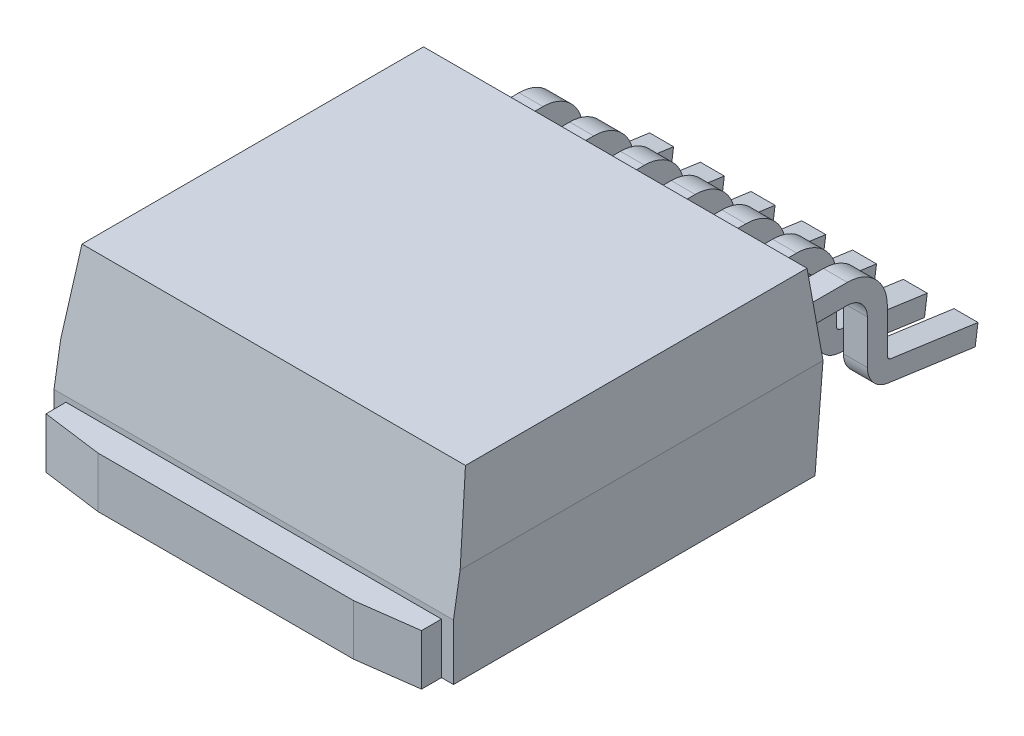
from build123d import *

# Parameters (mm, degrees)
MAIN_BODY_DEPTH               = 5
ICP_CUT_W                     = 8.5
ICP_CUT_H                     = 6.85
BACK_IC_PLATE_CUT_DEPTH       = 1.27
BACK_IC_PLATE_DEPTH           = 1.27
IC_LEG_DEPTH                  = 0.3
IC_LEG_JOINT_COMPLETION_REACH = 13.973
LC_W                          = 0.6
LC_H                          = 0.5
SIDE_CHAMFER_DEPTH            = 12.597722784
LP_START                      = 3.51
LP_IC_LEGS_DEPTH              = 0.6
LP_START_2                    = 2.24
LP_IC_LEGS_2_DEPTH            = 0.6
LP_START_3                    = 0.97
LP_IC_LEGS_3_DEPTH            = 0.6
LP_START_4                    = -4.11
LP_IC_LEGS_4_DEPTH            = 0.6
LP_START_5                    = -2.84
LP_IC_LEGS_5_DEPTH            = 0.6
LP_START_6                    = -1.57
LP_IC_LEGS_6_DEPTH            = 0.6
LP_IC_LEGS_7_DEPTH            = 0.6
LP_IC_LEGS_8_DEPTH            = 0.6
LP_IC_LEGS_9_DEPTH            = 0.6
LP_IC_LEGS_10_DEPTH           = 0.6
LP_IC_LEGS_11_DEPTH           = 0.6
LP_IC_LEGS_12_DEPTH           = 0.6


# Read off the part's stored shape, not the designer's step: LP IC LEGS
with BuildPart() as part:
    # MB → MAIN BODY (new, symmetric)
    with BuildSketch(Plane(origin=(0, 0, 0), x_dir=(0, 0, -1), z_dir=(1, 0, 0))):
        Polygon((4.525, 4.4), (-4.025, 4.4), (-4.525, 1.4), (-4.525, 0), (4.525, 0), (4.725, 2.4), align=None)
    extrude(amount=MAIN_BODY_DEPTH, both=True)

    # ICP CUT → BACK IC PLATE CUT (cut)
    with BuildSketch(Plane(origin=(0, 0, 0), x_dir=(-1, 0, 0), z_dir=(0, -1, 0))):
        with Locations((0, -1.1)):
            Rectangle(ICP_CUT_W, ICP_CUT_H)
    extrude(amount=-BACK_IC_PLATE_CUT_DEPTH, mode=Mode.SUBTRACT)


with BuildPart() as body_2:
    # ICP → BACK IC PLATE (new body)
    with BuildSketch(Plane.XZ.offset(-1.27)):
        Polygon((-4.25, 4.525), (-4.7, 4.525), (-4.7, 5.025), (-3.2, 5.225), (3.2, 5.225), (4.7, 5.025), (4.7, 4.525), (4.25, 4.525), (4.25, -2.325), (-4.25, -2.325), align=None)
    extrude(amount=BACK_IC_PLATE_DEPTH)


with BuildPart() as body_3:
    # Sketch3 → IC LEG (new, symmetric)
    with BuildSketch(Plane(origin=(0, 0, 0), x_dir=(0, 0, -1), z_dir=(1, 0, 0))):
        with BuildLine():
            Line((4.725, 2.4), (6.225, 2.4))
            ThreePointArc((6.225, 2.4), (6.578553391, 2.253553391), (6.725, 1.9))
            Line((6.725, 1.9), (6.725, 0.801032296))
            ThreePointArc((6.725, 0.801032296), (6.872174252, 0.407396879), (7.241496139, 0.206871455))
            Line((7.241496139, 0.206871455), (9.425, -0.1))
            Line((9.425, -0.1), (9.49458655, 0.395134034))
            Line((9.49458655, 0.395134034), (7.31108269, 0.70200549))
            ThreePointArc((7.31108269, 0.70200549), (7.249529042, 0.735426393), (7.225, 0.801032296))
            Line((7.225, 0.801032296), (7.225, 1.9))
            ThreePointArc((7.225, 1.9), (6.932106781, 2.607106781), (6.225, 2.9))
            Line((6.225, 2.9), (4.725, 2.9))
            Line((4.725, 2.9), (4.725, 2.4))
        make_face()
    extrude(amount=IC_LEG_DEPTH, both=True)


with BuildPart() as body_4:

    # LC → IC LEG JOINT COMPLETION (new, up to next)
    with BuildSketch(Plane.XY.offset(-4.725), mode=Mode.PRIVATE) as ic_leg_joint_completion_sk1:
        with Locations((0, 2.65)):
            Rectangle(LC_W, LC_H)
    ic_leg_joint_completion_tool1 = extrude(ic_leg_joint_completion_sk1.sketch, amount=IC_LEG_JOINT_COMPLETION_REACH, mode=Mode.PRIVATE) - part.part
    add(ic_leg_joint_completion_tool1.solids().sort_by_distance((0, 2.65, -4.725))[0])


with BuildPart() as part_1:
    add(part.part)

    # CHAMFER CUTS → SIDE CHAMFER (cut, symmetric)
    with BuildSketch(Plane.XY):
        Polygon((4.8, 4.4), (5, 4.4), (5, 2.4), align=None)
    side_chamfer = extrude(amount=SIDE_CHAMFER_DEPTH, both=True, mode=Mode.SUBTRACT)

    # SC M: SIDE CHAMFER across plane
    add(side_chamfer.mirror(Plane(origin=(0, 0, 0), x_dir=(0, 0, 1), z_dir=(1, 0, 0))), mode=Mode.SUBTRACT)


with BuildPart() as body_5:
    # LP IC LEGS outline → LP IC LEGS (new body)
    with BuildSketch(Plane.YZ.offset(LP_START)):
        Polygon((2.9, -4.725), (2.9, -4.675), (2.4, -4.725), align=None)
    extrude(amount=LP_IC_LEGS_DEPTH)


with BuildPart() as body_6:
    # LP IC LEGS 2 outline → LP IC LEGS 2 (new body)
    with BuildSketch(Plane.YZ.offset(LP_START_2)):
        Polygon((2.9, -4.725), (2.9, -4.675), (2.4, -4.725), align=None)
    extrude(amount=LP_IC_LEGS_2_DEPTH)


with BuildPart() as body_7:
    # LP IC LEGS 3 outline → LP IC LEGS 3 (new body)
    with BuildSketch(Plane.YZ.offset(LP_START_3)):
        Polygon((2.9, -4.725), (2.9, -4.675), (2.4, -4.725), align=None)
    extrude(amount=LP_IC_LEGS_3_DEPTH)


with BuildPart() as body_8:
    # LP IC LEGS 4 outline → LP IC LEGS 4 (new body)
    with BuildSketch(Plane.YZ.offset(LP_START_4)):
        Polygon((2.9, -4.725), (2.9, -4.675), (2.4, -4.725), align=None)
    extrude(amount=LP_IC_LEGS_4_DEPTH)


with BuildPart() as body_9:
    # LP IC LEGS 5 outline → LP IC LEGS 5 (new body)
    with BuildSketch(Plane.YZ.offset(LP_START_5)):
        Polygon((2.9, -4.725), (2.9, -4.675), (2.4, -4.725), align=None)
    extrude(amount=LP_IC_LEGS_5_DEPTH)


with BuildPart() as body_10:
    # LP IC LEGS 6 outline → LP IC LEGS 6 (new body)
    with BuildSketch(Plane.YZ.offset(LP_START_6)):
        Polygon((2.9, -4.725), (2.9, -4.675), (2.4, -4.725), align=None)
    extrude(amount=LP_IC_LEGS_6_DEPTH)


with BuildPart() as body_11:
    # LP IC LEGS 7 outline → LP IC LEGS 7 (new body)
    with BuildSketch(Plane.YZ.offset(LP_START)):
        with BuildLine():
            Line((0.206871455, -7.241496139), (-0.1, -9.425))
            Line((-0.1, -9.425), (0.395134034, -9.49458655))
            Line((0.395134034, -9.49458655), (0.70200549, -7.31108269))
            ThreePointArc((0.70200549, -7.31108269), (0.735426393, -7.249529042), (0.801032296, -7.225))
            Line((0.801032296, -7.225), (1.9, -7.225))
            ThreePointArc((1.9, -7.225), (2.607106781, -6.932106781), (2.9, -6.225))
            Line((2.9, -6.225), (2.9, -4.725))
            Line((2.9, -4.725), (2.4, -4.725))
            Line((2.4, -4.725), (2.4, -6.225))
            ThreePointArc((2.4, -6.225), (2.253553391, -6.578553391), (1.9, -6.725))
            Line((1.9, -6.725), (0.801032296, -6.725))
            ThreePointArc((0.801032296, -6.725), (0.407396879, -6.872174252), (0.206871455, -7.241496139))
        make_face()
    extrude(amount=LP_IC_LEGS_7_DEPTH)


with BuildPart() as body_12:
    # LP IC LEGS 8 outline → LP IC LEGS 8 (new body)
    with BuildSketch(Plane.YZ.offset(LP_START_2)):
        with BuildLine():
            Line((0.206871455, -7.241496139), (-0.1, -9.425))
            Line((-0.1, -9.425), (0.395134034, -9.49458655))
            Line((0.395134034, -9.49458655), (0.70200549, -7.31108269))
            ThreePointArc((0.70200549, -7.31108269), (0.735426393, -7.249529042), (0.801032296, -7.225))
            Line((0.801032296, -7.225), (1.9, -7.225))
            ThreePointArc((1.9, -7.225), (2.607106781, -6.932106781), (2.9, -6.225))
            Line((2.9, -6.225), (2.9, -4.725))
            Line((2.9, -4.725), (2.4, -4.725))
            Line((2.4, -4.725), (2.4, -6.225))
            ThreePointArc((2.4, -6.225), (2.253553391, -6.578553391), (1.9, -6.725))
            Line((1.9, -6.725), (0.801032296, -6.725))
            ThreePointArc((0.801032296, -6.725), (0.407396879, -6.872174252), (0.206871455, -7.241496139))
        make_face()
    extrude(amount=LP_IC_LEGS_8_DEPTH)


with BuildPart() as body_13:
    # LP IC LEGS 9 outline → LP IC LEGS 9 (new body)
    with BuildSketch(Plane.YZ.offset(LP_START_3)):
        with BuildLine():
            Line((0.206871455, -7.241496139), (-0.1, -9.425))
            Line((-0.1, -9.425), (0.395134034, -9.49458655))
            Line((0.395134034, -9.49458655), (0.70200549, -7.31108269))
            ThreePointArc((0.70200549, -7.31108269), (0.735426393, -7.249529042), (0.801032296, -7.225))
            Line((0.801032296, -7.225), (1.9, -7.225))
            ThreePointArc((1.9, -7.225), (2.607106781, -6.932106781), (2.9, -6.225))
            Line((2.9, -6.225), (2.9, -4.725))
            Line((2.9, -4.725), (2.4, -4.725))
            Line((2.4, -4.725), (2.4, -6.225))
            ThreePointArc((2.4, -6.225), (2.253553391, -6.578553391), (1.9, -6.725))
            Line((1.9, -6.725), (0.801032296, -6.725))
            ThreePointArc((0.801032296, -6.725), (0.407396879, -6.872174252), (0.206871455, -7.241496139))
        make_face()
    extrude(amount=LP_IC_LEGS_9_DEPTH)


with BuildPart() as body_14:
    # LP IC LEGS 10 outline → LP IC LEGS 10 (new body)
    with BuildSketch(Plane.YZ.offset(LP_START_4)):
        with BuildLine():
            Line((0.206871455, -7.241496139), (-0.1, -9.425))
            Line((-0.1, -9.425), (0.395134034, -9.49458655))
            Line((0.395134034, -9.49458655), (0.70200549, -7.31108269))
            ThreePointArc((0.70200549, -7.31108269), (0.735426393, -7.249529042), (0.801032296, -7.225))
            Line((0.801032296, -7.225), (1.9, -7.225))
            ThreePointArc((1.9, -7.225), (2.607106781, -6.932106781), (2.9, -6.225))
            Line((2.9, -6.225), (2.9, -4.725))
            Line((2.9, -4.725), (2.4, -4.725))
            Line((2.4, -4.725), (2.4, -6.225))
            ThreePointArc((2.4, -6.225), (2.253553391, -6.578553391), (1.9, -6.725))
            Line((1.9, -6.725), (0.801032296, -6.725))
            ThreePointArc((0.801032296, -6.725), (0.407396879, -6.872174252), (0.206871455, -7.241496139))
        make_face()
    extrude(amount=LP_IC_LEGS_10_DEPTH)


with BuildPart() as body_15:
    # LP IC LEGS 11 outline → LP IC LEGS 11 (new body)
    with BuildSketch(Plane.YZ.offset(LP_START_5)):
        with BuildLine():
            Line((0.206871455, -7.241496139), (-0.1, -9.425))
            Line((-0.1, -9.425), (0.395134034, -9.49458655))
            Line((0.395134034, -9.49458655), (0.70200549, -7.31108269))
            ThreePointArc((0.70200549, -7.31108269), (0.735426393, -7.249529042), (0.801032296, -7.225))
            Line((0.801032296, -7.225), (1.9, -7.225))
            ThreePointArc((1.9, -7.225), (2.607106781, -6.932106781), (2.9, -6.225))
            Line((2.9, -6.225), (2.9, -4.725))
            Line((2.9, -4.725), (2.4, -4.725))
            Line((2.4, -4.725), (2.4, -6.225))
            ThreePointArc((2.4, -6.225), (2.253553391, -6.578553391), (1.9, -6.725))
            Line((1.9, -6.725), (0.801032296, -6.725))
            ThreePointArc((0.801032296, -6.725), (0.407396879, -6.872174252), (0.206871455, -7.241496139))
        make_face()
    extrude(amount=LP_IC_LEGS_11_DEPTH)


with BuildPart() as body_16:
    # LP IC LEGS 12 outline → LP IC LEGS 12 (new body)
    with BuildSketch(Plane.YZ.offset(LP_START_6)):
        with BuildLine():
            Line((0.206871455, -7.241496139), (-0.1, -9.425))
            Line((-0.1, -9.425), (0.395134034, -9.49458655))
            Line((0.395134034, -9.49458655), (0.70200549, -7.31108269))
            ThreePointArc((0.70200549, -7.31108269), (0.735426393, -7.249529042), (0.801032296, -7.225))
            Line((0.801032296, -7.225), (1.9, -7.225))
            ThreePointArc((1.9, -7.225), (2.607106781, -6.932106781), (2.9, -6.225))
            Line((2.9, -6.225), (2.9, -4.725))
            Line((2.9, -4.725), (2.4, -4.725))
            Line((2.4, -4.725), (2.4, -6.225))
            ThreePointArc((2.4, -6.225), (2.253553391, -6.578553391), (1.9, -6.725))
            Line((1.9, -6.725), (0.801032296, -6.725))
            ThreePointArc((0.801032296, -6.725), (0.407396879, -6.872174252), (0.206871455, -7.241496139))
        make_face()
    extrude(amount=LP_IC_LEGS_12_DEPTH)


solid = Compound([body_2.part, body_3.part, body_4.part, part_1.part, body_5.part, body_6.part, body_7.part, body_8.part, body_9.part, body_10.part, body_11.part, body_12.part, body_13.part, body_14.part, body_15.part, body_16.part])
